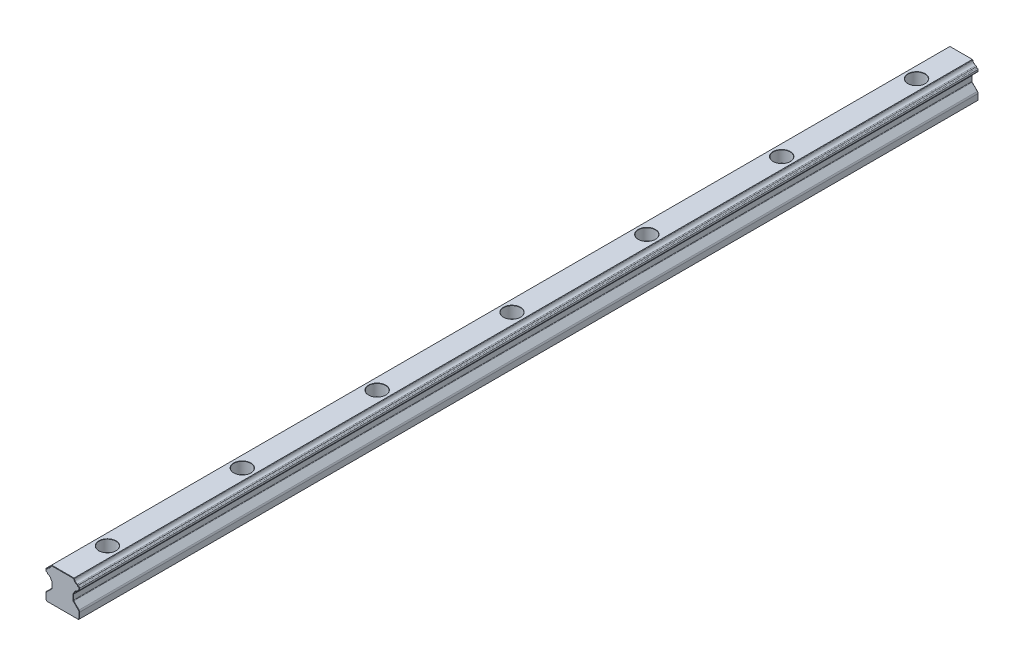
from build123d import *

# Parameters (mm, degrees)
BODY_DEPTH                                 = 400
AESTHETIC_CHAMFER_SIZE                     = 0.15
PRODUCTION_FILLET_R                        = 0.1
MOUNTING_HOLES_PATTERN_COUNT               = 7
MOUNTING_HOLES_PATTERN_PITCH               = 60
PRODUCTION_FILLET_OF_MOUNTING_HOLES_PATT_R = 0.1


with BuildPart() as part:
    # Rail Profile → Body (new body)
    with BuildSketch(Plane.XY):
        with BuildLine():
            Line((-7, 0), (7, 0))
            Line((7, 0), (7.5, 0.5))
            Line((7.5, 0.5), (7.5, 3.085786438))
            ThreePointArc((7.5, 3.085786438), (7.423879533, 3.46846987), (7.207106781, 3.792893219))
            Line((7.207106781, 3.792893219), (4.867157288, 6.132842712))
            ThreePointArc((4.867157288, 6.132842712), (4.780448187, 6.262612052), (4.75, 6.415685425))
            Line((4.75, 6.415685425), (4.75, 8.584314575))
            ThreePointArc((4.75, 8.584314575), (4.780448187, 8.737387948), (4.867157288, 8.867157288))
            Line((4.867157288, 8.867157288), (5.062965362, 9.062965362))
            ThreePointArc((5.062965362, 9.062965362), (5.134996734, 9.161242682), (5.17409812, 9.27664646))
            ThreePointArc((5.17409812, 9.27664646), (5.61862915, 10.13137085), (6.47335354, 10.57590188))
            ThreePointArc((6.47335354, 10.57590188), (6.694124352, 10.694306692), (6.801170165, 10.920803148))
            ThreePointArc((6.801170165, 10.920803148), (6.915305692, 11.154571658), (7.149074202, 11.268707185))
            ThreePointArc((7.149074202, 11.268707185), (7.399691242, 11.400760606), (7.5, 11.665685425))
            Line((7.5, 11.665685425), (7.5, 12.334314575))
            ThreePointArc((7.5, 12.334314575), (7.399691242, 12.599239394), (7.149074202, 12.731292815))
            ThreePointArc((7.149074202, 12.731292815), (6.915305692, 12.845428342), (6.801170165, 13.079196852))
            ThreePointArc((6.801170165, 13.079196852), (6.694124352, 13.305693308), (6.47335354, 13.42409812))
            ThreePointArc((6.47335354, 13.42409812), (5.61862915, 13.86862915), (5.17409812, 14.72335354))
            ThreePointArc((5.17409812, 14.72335354), (5.134996734, 14.838757318), (5.062965362, 14.937034638))
            Line((5.062965362, 14.937034638), (5, 15))
            Line((5, 15), (-5, 15))
            Line((-5, 15), (-5.062965362, 14.937034638))
            ThreePointArc((-5.062965362, 14.937034638), (-5.134996734, 14.838757318), (-5.17409812, 14.72335354))
            ThreePointArc((-5.17409812, 14.72335354), (-5.61862915, 13.86862915), (-6.47335354, 13.42409812))
            ThreePointArc((-6.47335354, 13.42409812), (-6.694124352, 13.305693308), (-6.801170165, 13.079196852))
            ThreePointArc((-6.801170165, 13.079196852), (-6.915305692, 12.845428342), (-7.149074202, 12.731292815))
            ThreePointArc((-7.149074202, 12.731292815), (-7.399691242, 12.599239394), (-7.5, 12.334314575))
            Line((-7.5, 12.334314575), (-7.5, 11.665685425))
            ThreePointArc((-7.5, 11.665685425), (-7.399691242, 11.400760606), (-7.149074202, 11.268707185))
            ThreePointArc((-7.149074202, 11.268707185), (-6.915305692, 11.154571658), (-6.801170165, 10.920803148))
            ThreePointArc((-6.801170165, 10.920803148), (-6.694124352, 10.694306692), (-6.47335354, 10.57590188))
            ThreePointArc((-6.47335354, 10.57590188), (-5.61862915, 10.13137085), (-5.17409812, 9.27664646))
            ThreePointArc((-5.17409812, 9.27664646), (-5.134996734, 9.161242682), (-5.062965362, 9.062965362))
            Line((-5.062965362, 9.062965362), (-4.867157288, 8.867157288))
            ThreePointArc((-4.867157288, 8.867157288), (-4.780448187, 8.737387948), (-4.75, 8.584314575))
            Line((-4.75, 8.584314575), (-4.75, 6.415685425))
            ThreePointArc((-4.75, 6.415685425), (-4.780448187, 6.262612052), (-4.867157288, 6.132842712))
            Line((-4.867157288, 6.132842712), (-7.207106781, 3.792893219))
            ThreePointArc((-7.207106781, 3.792893219), (-7.423879533, 3.46846987), (-7.5, 3.085786438))
            Line((-7.5, 3.085786438), (-7.5, 0.5))
            Line((-7.5, 0.5), (-7, 0))
        make_face()
    extrude(amount=-BODY_DEPTH)

    # Aesthetic Chamfer
    aesthetic_chamfer_edges = [part.edges().sort_by_distance(p)[0] for p in [
        (-5.031482681, 14.968517319, 0),
        (-5.134996734, 14.838757318, 0),
        (-5.61862915, 13.86862915, 0),
        (-6.694124352, 13.305693308, 0),
        (-6.915305692, 12.845428342, 0),
        (-7.399691242, 12.599239394, 0),
        (-7.5, 12, 0),
        (-7.399691242, 11.400760606, 0),
        (-6.915305692, 11.154571658, 0),
        (-6.694124352, 10.694306692, 0),
        (-5.61862915, 10.13137085, 0),
        (-5.134996734, 9.161242682, 0),
        (-4.965061325, 8.965061325, 0),
        (-4.780448187, 8.737387948, 0),
        (-4.75, 7.5, 0),
        (-4.780448187, 6.262612052, 0),
        (-6.037132034, 4.962867966, 0),
        (-7.423879533, 3.46846987, 0),
        (-7.5, 1.792893219, 0),
        (-7.25, 0.25, 0),
        (0, 0, 0),
        (7.25, 0.25, 0),
        (5.031482681, 14.968517319, 0),
        (5.134996734, 14.838757318, 0),
        (5.61862915, 13.86862915, 0),
        (6.694124352, 13.305693308, 0),
        (6.915305692, 12.845428342, 0),
        (7.399691242, 12.599239394, 0),
        (7.5, 12, 0),
        (7.399691242, 11.400760606, 0),
        (6.915305692, 11.154571658, 0),
        (6.694124352, 10.694306692, 0),
        (5.61862915, 10.13137085, 0),
        (5.134996734, 9.161242682, 0),
        (4.965061325, 8.965061325, 0),
        (4.780448187, 8.737387948, 0),
        (7.5, 1.792893219, 0),
        (4.75, 7.5, 0),
        (7.423879533, 3.46846987, 0),
        (4.780448187, 6.262612052, 0),
        (6.037132034, 4.962867966, 0),
        (0, 15, 0),
        (5.031482681, 14.968517319, -400),
        (5.134996734, 14.838757318, -400),
        (5.61862915, 13.86862915, -400),
        (6.694124352, 13.305693308, -400),
        (6.915305692, 12.845428342, -400),
        (7.399691242, 12.599239394, -400),
        (7.5, 12, -400),
        (7.399691242, 11.400760606, -400),
        (6.915305692, 11.154571658, -400),
        (6.694124352, 10.694306692, -400),
        (5.61862915, 10.13137085, -400),
        (5.134996734, 9.161242682, -400),
        (4.965061325, 8.965061325, -400),
        (4.780448187, 8.737387948, -400),
        (4.75, 7.5, -400),
        (4.780448187, 6.262612052, -400),
        (6.037132034, 4.962867966, -400),
        (7.423879533, 3.46846987, -400),
        (7.5, 1.792893219, -400),
        (7.25, 0.25, -400),
        (0, 0, -400),
        (-7.25, 0.25, -400),
        (-5.031482681, 14.968517319, -400),
        (-5.134996734, 14.838757318, -400),
        (-5.61862915, 13.86862915, -400),
        (-6.694124352, 13.305693308, -400),
        (-6.915305692, 12.845428342, -400),
        (-7.399691242, 12.599239394, -400),
        (-7.5, 12, -400),
        (-7.399691242, 11.400760606, -400),
        (-6.915305692, 11.154571658, -400),
        (-6.694124352, 10.694306692, -400),
        (-5.61862915, 10.13137085, -400),
        (-7.5, 1.792893219, -400),
        (-5.134996734, 9.161242682, -400),
        (-7.423879533, 3.46846987, -400),
        (-4.965061325, 8.965061325, -400),
        (-6.037132034, 4.962867966, -400),
        (-4.780448187, 8.737387948, -400),
        (-4.780448187, 6.262612052, -400),
        (-4.75, 7.5, -400),
        (0, 15, -400),
    ]]
    chamfer(aesthetic_chamfer_edges, length=AESTHETIC_CHAMFER_SIZE)

    # Sketch1 → Mounting Hole (revolve, cut)
    with BuildSketch(Plane(origin=(0, 15, -20), x_dir=(0, 0, 1), z_dir=(1, 0, 0))):
        Polygon((0, 0), (0, 15), (2.35, 15), (2.25, 14.9), (2.25, 5.4), (2.35, 5.3), (3.75, 5.3), (3.75, 0.1), (3.85, 0), align=None)
    mounting_hole = revolve(axis=Axis((0, 21.35, -20), (0, -1, 0)), mode=Mode.SUBTRACT)

    # Production Fillet
    production_fillet_edges = [part.edges().sort_by_distance(p)[0] for p in [
        (0, 9.7, -23.75),
    ]]
    fillet(production_fillet_edges, radius=PRODUCTION_FILLET_R)

    # Mounting Holes Pattern: Mounting Hole ×7
    with Locations(*[(0, 0, -i * MOUNTING_HOLES_PATTERN_PITCH) for i in range(1, MOUNTING_HOLES_PATTERN_COUNT)]):
        add(mounting_hole, mode=Mode.SUBTRACT)

    # Production Fillet of Mounting Holes Patt
    production_fillet_of_mounting_holes_patt_edges = [part.edges().sort_by_distance(p)[0] for p in [
        (0, 9.7, -83.75),
        (0, 9.7, -143.75),
        (0, 9.7, -203.75),
        (0, 9.7, -263.75),
        (0, 9.7, -323.75),
        (0, 9.7, -383.75),
    ]]
    fillet(production_fillet_of_mounting_holes_patt_edges, radius=PRODUCTION_FILLET_OF_MOUNTING_HOLES_PATT_R)


solid = part.part
